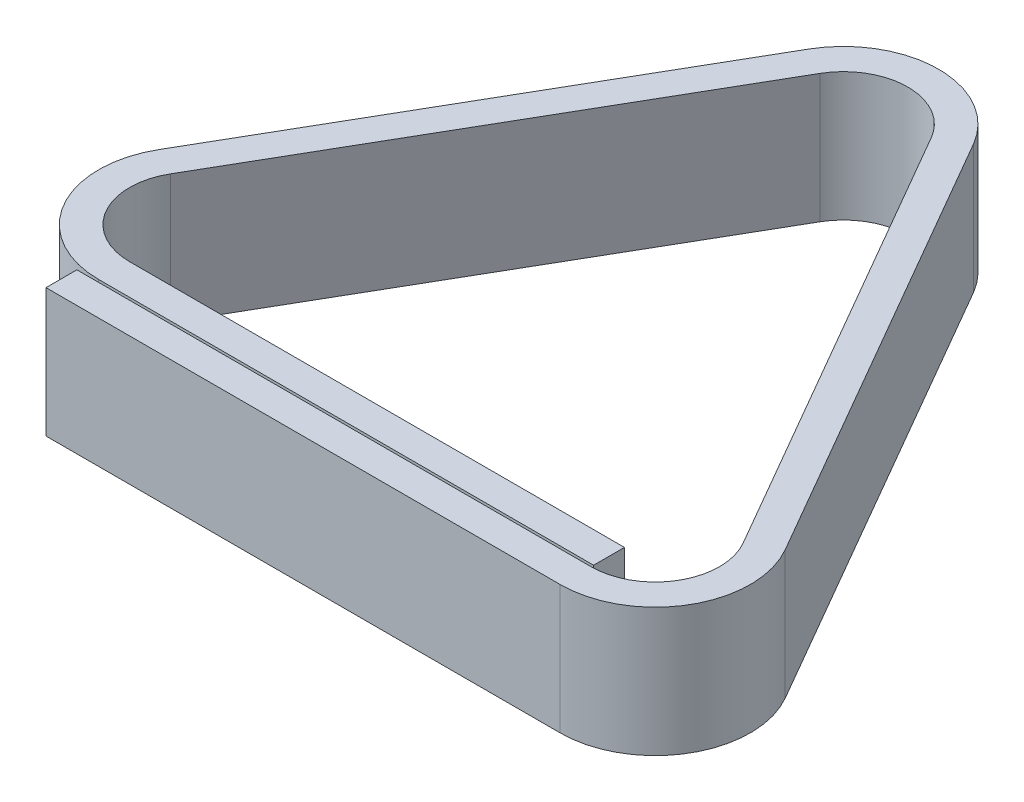
from build123d import *

# Parameters (mm, degrees)
BOSS_EXTRU_1_DEPTH = 10


with BuildPart() as part:
    # Esquisse1 → Boss.-Extru.1 (new body)
    with BuildSketch(Plane(origin=(0, 0, 0), x_dir=(1, 0, 0), z_dir=(0, 1, 0))):
        with BuildLine():
            Line((0, 0), (40, 0))
            ThreePointArc((40, 0), (44.330127019, 2.5), (44.330127019, 7.5))
            Line((44.330127019, 7.5), (24.330127019, 42.141016151))
            ThreePointArc((24.330127019, 42.141016151), (20, 44.641016151), (15.669872981, 42.141016151))
            Line((15.669872981, 42.141016151), (-2.829016319, 10.1))
            ThreePointArc((-2.829016319, 10.1), (-2.829016319, 5.1), (1.5011107, 2.6))
            Line((1.5011107, 2.6), (40, 2.6))
            Line((40, 2.6), (40, 0.2))
            Line((40, 0.2), (1.5011107, 0.2))
            ThreePointArc((1.5011107, 0.2), (-4.907477288, 3.9), (-4.907477288, 11.3))
            Line((-4.907477288, 11.3), (13.591412012, 43.341016151))
            ThreePointArc((13.591412012, 43.341016151), (20, 47.041016151), (26.408587988, 43.341016151))
            Line((26.408587988, 43.341016151), (46.408587988, 8.7))
            ThreePointArc((46.408587988, 8.7), (46.408587988, 1.3), (40, -2.4))
            Line((40, -2.4), (0, -2.4))
            Line((0, -2.4), (0, 0))
        make_face()
    extrude(amount=BOSS_EXTRU_1_DEPTH)


solid = part.part
